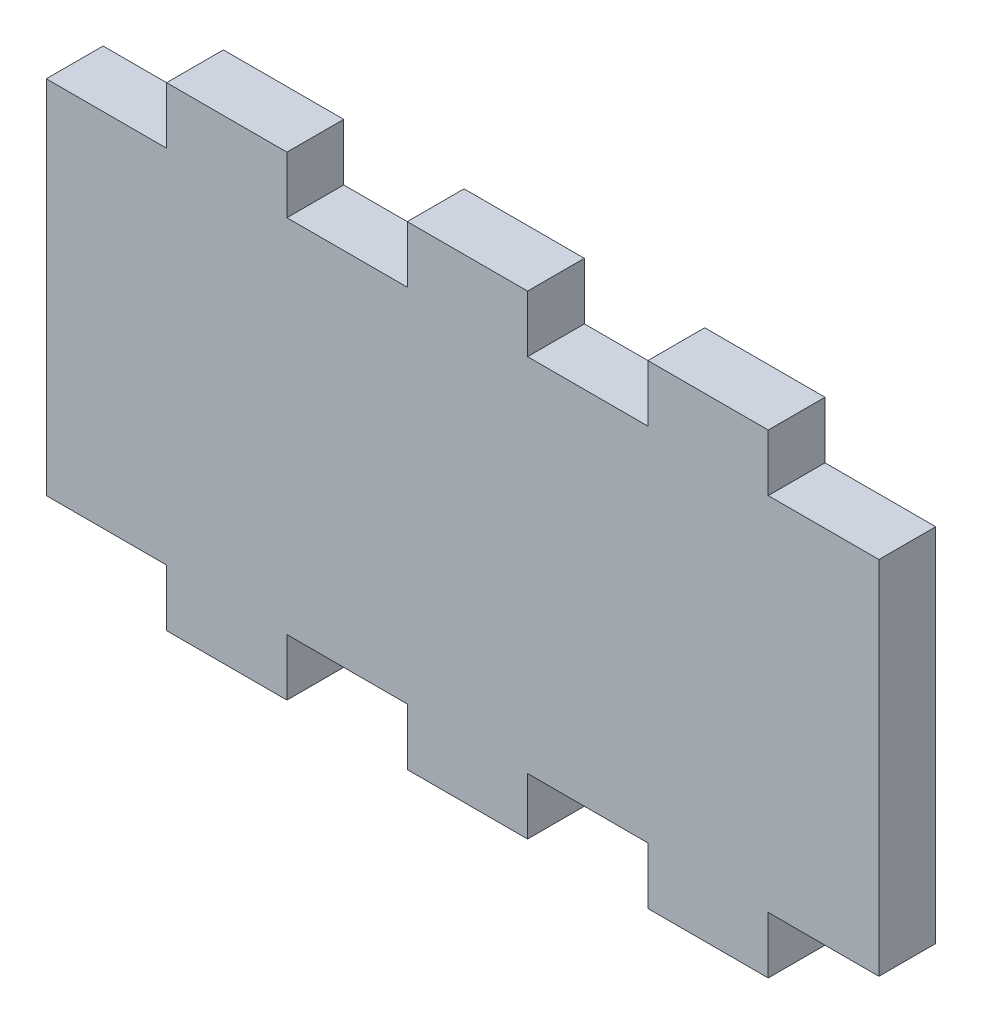
from build123d import *

# Parameters (mm, degrees)
SKETCH1_W               = 43.942
SKETCH1_H               = 19.05
BODY_DEPTH              = 2.9972
SKETCH2_W               = 6.35
SKETCH2_H               = 2.9972
TAB_DEPTH               = 2.9972
LPATTERN1_COUNT         = 3
LPATTERN1_PITCH         = 12.7
MIRROR1_COPY_1_SKETCH_W = 6.35
MIRROR1_COPY_1_SKETCH_H = 2.9972
MIRROR1_COPY_1_DEPTH    = 2.9972
MIRROR1_COPY_2_SKETCH_W = 6.35
MIRROR1_COPY_2_SKETCH_H = 2.9972
MIRROR1_COPY_2_DEPTH    = 2.9972
MIRROR1_COPY_3_SKETCH_W = 6.35
MIRROR1_COPY_3_SKETCH_H = 2.9972
MIRROR1_COPY_3_DEPTH    = 2.9972


with BuildPart() as part:
    # Sketch1 → Body (new body)
    with BuildSketch(Plane.XY):
        Rectangle(SKETCH1_W, SKETCH1_H)
    extrude(amount=BODY_DEPTH)

    # Sketch2 → Tab (add)
    with BuildSketch(Plane(origin=(0, 9.525, 0), x_dir=(1, 0, 0), z_dir=(0, 1, 0))):
        with Locations((-12.446, -1.4986)):
            Rectangle(SKETCH2_W, SKETCH2_H)
    tab = extrude(amount=TAB_DEPTH)

    # LPattern1: Tab ×3
    with Locations(*[(i * LPATTERN1_PITCH, 0, 0) for i in range(1, LPATTERN1_COUNT)]):
        add(tab)

    # Mirror1 copy 1 sketch → Mirror1 copy 1 (add)
    with BuildSketch(Plane(origin=(12.7, -9.525, 0), x_dir=(1, 0, 0), z_dir=(0, -1, 0))):
        with Locations((-12.446, 1.4986)):
            Rectangle(MIRROR1_COPY_1_SKETCH_W, MIRROR1_COPY_1_SKETCH_H)
    extrude(amount=MIRROR1_COPY_1_DEPTH)

    # Mirror1 copy 2 sketch → Mirror1 copy 2 (add)
    with BuildSketch(Plane(origin=(25.4, -9.525, 0), x_dir=(1, 0, 0), z_dir=(0, -1, 0))):
        with Locations((-12.446, 1.4986)):
            Rectangle(MIRROR1_COPY_2_SKETCH_W, MIRROR1_COPY_2_SKETCH_H)
    extrude(amount=MIRROR1_COPY_2_DEPTH)

    # Mirror1 copy 3 sketch → Mirror1 copy 3 (add)
    with BuildSketch(Plane.XZ.offset(9.525)):
        with Locations((-12.446, 1.4986)):
            Rectangle(MIRROR1_COPY_3_SKETCH_W, MIRROR1_COPY_3_SKETCH_H)
    extrude(amount=MIRROR1_COPY_3_DEPTH)


solid = part.part
